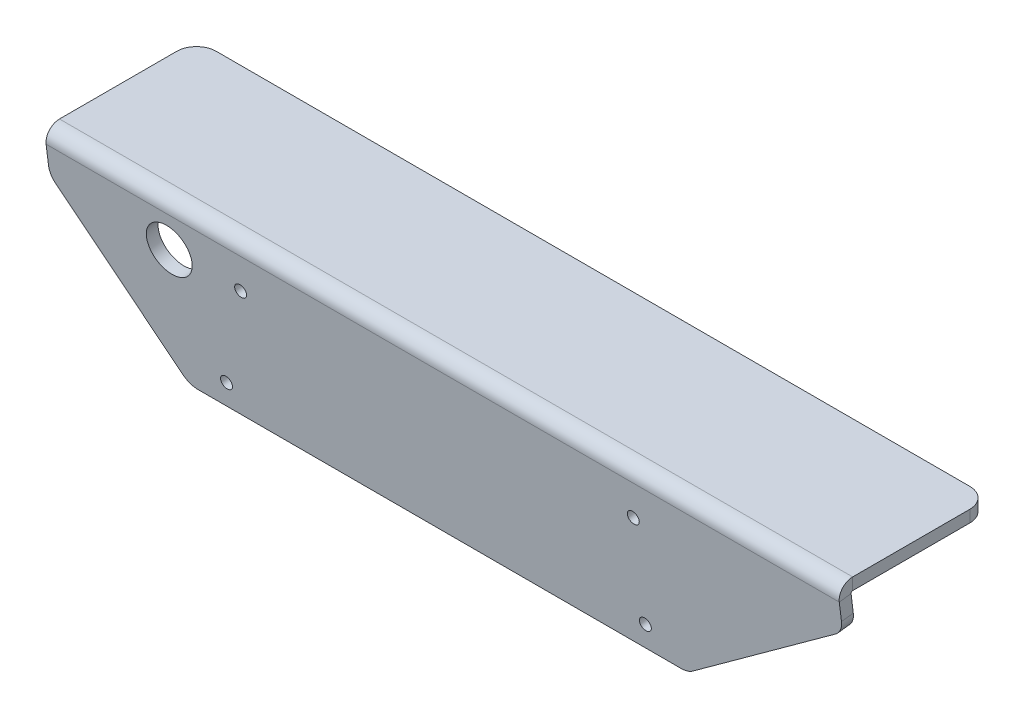
from build123d import *

# Parameters (mm, degrees)
BOSS_EXTRUDE1_DEPTH    = 400
SKETCH2_R              = 3
SKETCH2_R_2            = 11.5
CUT_EXTRUDE1_DEPTH     = 10
CUT_EXTRUDE2_DEPTH     = 411.492681542
FILLET1_R              = 10
FILLET2_R              = 10
CONVERT_SOLID1_DEPTH   = 400
CONVERT_SOLID1_2_DEPTH = 400


# Read off the part's stored shape, not the designer's step: Convert-Solid1
with BuildPart() as part:
    # Sketch1 → Boss-Extrude1 (new body)
    with BuildSketch(Plane(origin=(0, 0, 0), x_dir=(0, 0, -1), z_dir=(1, 0, 0))):
        Polygon((-30.250452528, -29.403692131), (-40, 50), (30, 50), (30, 56), (-46.781766318, 56), (-36.205729437, -30.134908192), align=None)
    extrude(amount=BOSS_EXTRUDE1_DEPTH)

    # Sketch2 → Cut-Extrude1 (cut)
    with BuildSketch(Plane(origin=(0, -4.827047129, 39.313144045), x_dir=(1, 0, 0), z_dir=(0, -0.12186934340515194, 0.9925461516413215))):
        with Locations(Location((96, 36.283847636, 0), (0, 0, 270))):
            Circle(SKETCH2_R)
        with Locations(Location((294, 36.283847636, 0), (0, 0, 270))):
            Circle(SKETCH2_R)
        with Locations(Location((294, -13.716152364, 0), (0, 0, 270))):
            Circle(SKETCH2_R)
        with Locations(Location((60, 36.283847636, 0), (0, 0, 270))):
            Circle(SKETCH2_R_2)
        with Locations(Location((82.79, -13.716152364, 0), (0, 0, 270))):
            Circle(SKETCH2_R)
    extrude(amount=-CUT_EXTRUDE1_DEPTH, mode=Mode.SUBTRACT)

    # Sketch3 → Cut-Extrude2 (cut, through all)
    with BuildSketch(Plane(origin=(0, -4.827047129, 39.313144045), x_dir=(1, 0, 0), z_dir=(0, -0.12186934340515194, 0.9925461516413215))):
        Polygon((314, -25.497918682), (400, 39.502081318), (421.348881307, 33.662382961), (421.69701633, -53.203923072), (314, -56.960779507), align=None)
        Polygon((-35.970836278, 39.502081318), (0, 39.502081318), (62.79, -25.497918682), (64.049370498, -44.831722112), (-31.822947487, -47.152069291), align=None)
    extrude(amount=-CUT_EXTRUDE2_DEPTH, mode=Mode.SUBTRACT)

    # Fillet1
    fillet1_edges = [part.edges().sort_by_distance(p)[0] for p in [
        (400, 34.746199695, 41.149598304),
        (314, -29.769300162, 33.228090983),
        (0, 34.746199695, 41.149598304),
        (62.79, -29.769300162, 33.228090983),
    ]]
    fillet(fillet1_edges, radius=FILLET1_R)

    # Fillet2
    fillet2_edges = [part.edges().sort_by_distance(p)[0] for p in [
        (400, 53, -30),
        (0, 53, -30),
    ]]
    fillet(fillet2_edges, radius=FILLET2_R)

    # Convert-Solid1 outline → Convert-Solid1 (cut)
    with BuildSketch(Plane.YZ):
        with BuildLine():
            ThreePointArc((48.371288465, 45.845078322), (53.705816328, 44.188663392), (56, 39.095764491))
            Line((56, 39.095764491), (56, 46.781766318))
            Line((56, 46.781766318), (48.371288465, 45.845078322))
        make_face()
    extrude(amount=CONVERT_SOLID1_DEPTH, mode=Mode.SUBTRACT)

    # Convert-Solid1 2 outline → Convert-Solid1 2 (add)
    with BuildSketch(Plane.YZ):
        with BuildLine():
            ThreePointArc((49.102504525, 39.889801412), (49.730096039, 39.694929068), (50, 39.095764491))
            Line((50, 39.095764491), (50, 40))
            Line((50, 40), (49.102504525, 39.889801412))
        make_face()
    extrude(amount=CONVERT_SOLID1_2_DEPTH)


solid = part.part
